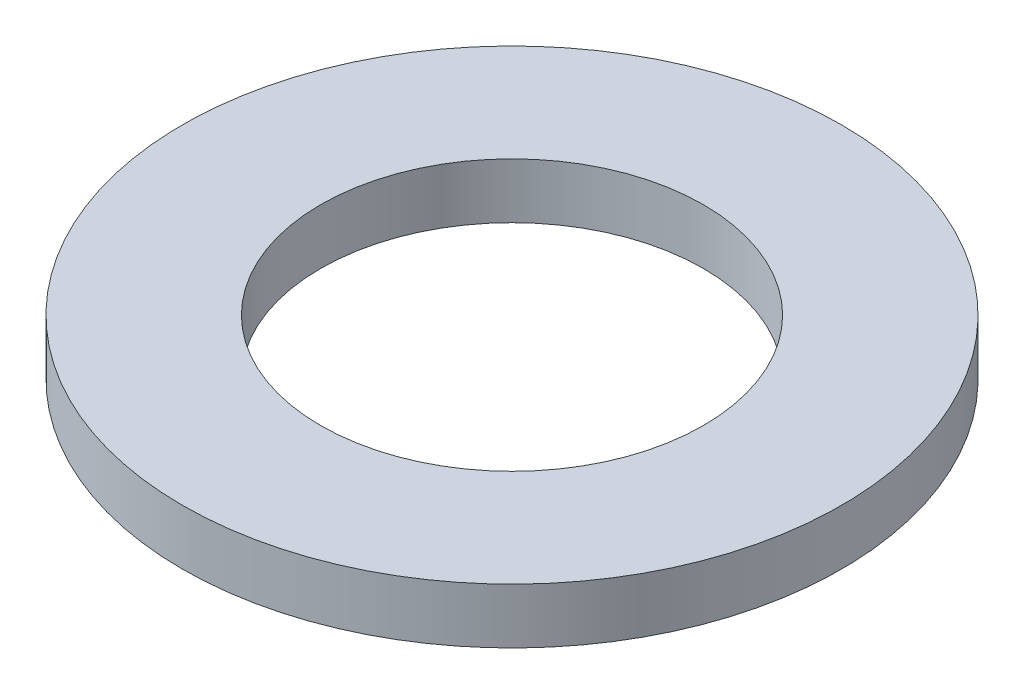
from build123d import *

# Parameters (mm, degrees)
SKETCH1_R           = 77.5
BOSS_EXTRUDE1_DEPTH = 13
SKETCH2_R           = 45
CUT_EXTRUDE1_DEPTH  = 111.369832835


with BuildPart() as part:
    # Sketch1 → Boss-Extrude1 (new body)
    with BuildSketch(Plane(origin=(0, 0, 0), x_dir=(1, 0, 0), z_dir=(0, 1, 0))):
        Circle(SKETCH1_R)
    extrude(amount=BOSS_EXTRUDE1_DEPTH)

    # Sketch2 → Cut-Extrude1 (cut, through all)
    with BuildSketch(Plane(origin=(0, 0, 0), x_dir=(1, 0, 0), z_dir=(0, 1, 0))):
        Circle(SKETCH2_R)
    extrude(amount=CUT_EXTRUDE1_DEPTH, mode=Mode.SUBTRACT)


solid = part.part
